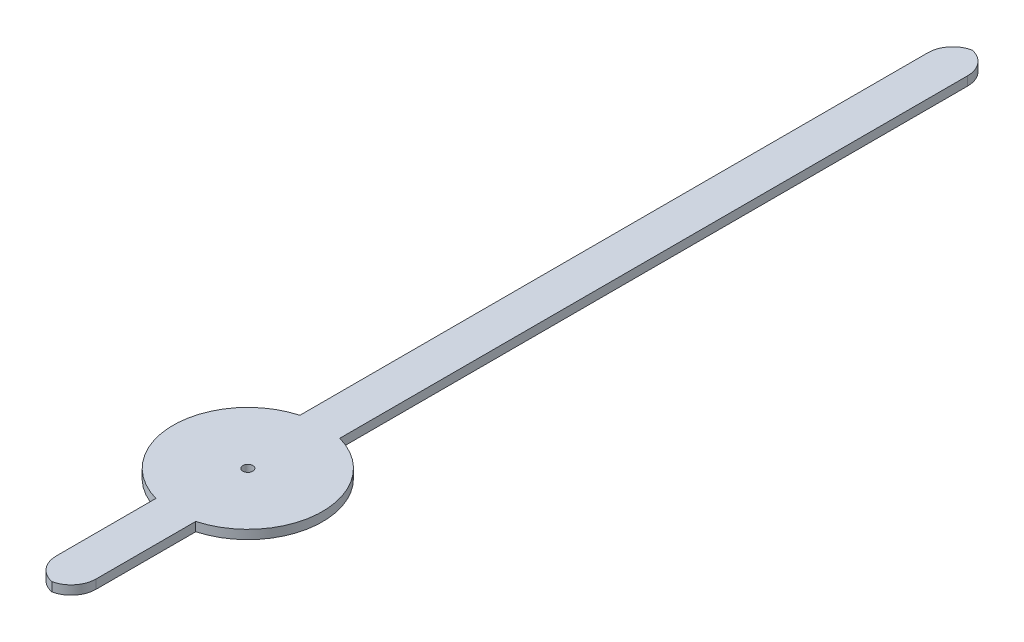
from build123d import *

# Parameters (mm, degrees)
SKETCH1_R           = 0.1
BOSS_EXTRUDE2_DEPTH = 0.18
FILLET1_R           = 0.5


with BuildPart() as part:
    # Sketch1 → Boss-Extrude2 (new body)
    with BuildSketch(Plane(origin=(0, 0, 0), x_dir=(1, 0, 0), z_dir=(0, 1, 0))):
        with BuildLine():
            Line((-0.4, -3.945683229), (-0.4, -1.445683229))
            ThreePointArc((-0.4, -1.445683229), (-1.5, 0), (-0.4, 1.445683229))
            Line((-0.4, 1.445683229), (-0.4, 14.554316771))
            Line((-0.4, 14.554316771), (0.4, 14.554316771))
            Line((0.4, 14.554316771), (0.4, 1.445683229))
            ThreePointArc((0.4, 1.445683229), (1.5, 0), (0.4, -1.445683229))
            Line((0.4, -1.445683229), (0.4, -3.945683229))
            Line((0.4, -3.945683229), (-0.4, -3.945683229))
        make_face()
        with Locations(Location((0, 0, 0), (0, 0, 270))):
            Circle(SKETCH1_R, mode=Mode.SUBTRACT)
    extrude(amount=BOSS_EXTRUDE2_DEPTH)

    # Fillet1
    # the kernel refuses this fillet: 0.5 mm, written as the material it takes off along each edge
    with BuildSketch(Plane(origin=(-0.4, -1.25, -14.554316771), x_dir=(0, 0, 1), z_dir=(0, 1, 0)), Plane(origin=(0.4, -1.25, -14.554316771), x_dir=(-1, 0, 0), z_dir=(0, 1, 0)), Plane(origin=(-0.4, -1.25, 3.945683229), x_dir=(1, 0, 0), z_dir=(0, 1, 0)), Plane(origin=(0.4, -1.25, 3.945683229), x_dir=(0, 0, -1), z_dir=(0, 1, 0))) as fillet1_piece_1:
        with BuildLine():
            CenterArc((FILLET1_R, FILLET1_R), FILLET1_R, 180, 90)
            Line((0, FILLET1_R), (0, 0))
            Line((0, 0), (FILLET1_R, 0))
        make_face()
    extrude(amount=2.68, mode=Mode.SUBTRACT)


solid = part.part
